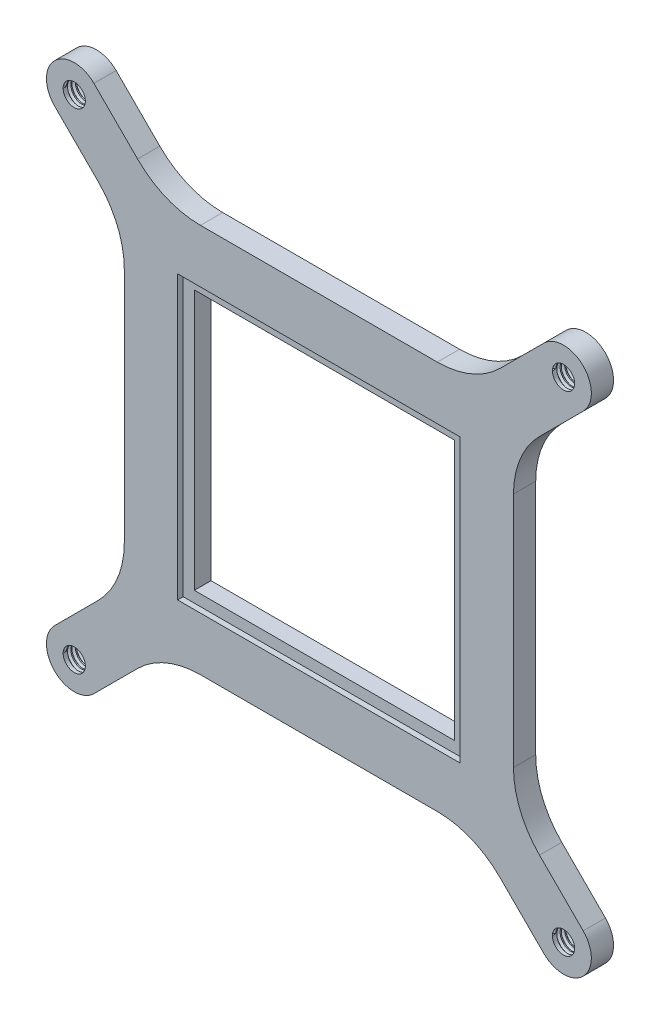
from build123d import *

# Parameters (mm, degrees)
SKETCH1_R           = 1
SKETCH1_W           = 23.4
SKETCH1_H           = 23.4
BOSS_EXTRUDE1_DEPTH = 2
SKETCH2_W           = 25.4
SKETCH2_H           = 25.4
CUT_EXTRUDE1_DEPTH  = 0.5
THREAD1_PITCH       = 0.4
THREAD2_PITCH       = 0.4
THREAD3_PITCH       = 0.4
THREAD4_PITCH       = 0.4


with BuildPart() as part:
    # Sketch1 → Boss-Extrude1 (new body)
    with BuildSketch(Plane.XY):
        with BuildLine():
            Line((-12.350483997, 18.242134063), (8.948233905, 18.242134063))
            ThreePointArc((8.948233905, 18.242134063), (12.00838523, 18.85055278), (14.60307322, 20.583265597))
            Line((14.60307322, 20.583265597), (18.533136312, 24.510530459))
            ThreePointArc((18.533136312, 24.510530459), (22.068040551, 24.509901016), (22.068669993, 20.974996777))
            Line((22.068669993, 20.974996777), (18.141405132, 17.044933685))
            ThreePointArc((18.141405132, 17.044933685), (16.408692315, 14.450245695), (15.800273598, 11.39009437))
            Line((15.800273598, 11.39009437), (15.800273598, -9.905826244))
            ThreePointArc((15.800273598, -9.905826244), (16.408692315, -12.965977569), (18.141405132, -15.560665559))
            Line((18.141405132, -15.560665559), (22.068669993, -19.490728651))
            ThreePointArc((22.068669993, -19.490728651), (22.068040551, -23.02563289), (18.533136312, -23.026262333))
            Line((18.533136312, -23.026262333), (14.60307322, -19.098997471))
            ThreePointArc((14.60307322, -19.098997471), (12.00838523, -17.366284654), (8.948233905, -16.757865937))
            Line((8.948233905, -16.757865937), (-12.350483997, -16.757865937))
            ThreePointArc((-12.350483997, -16.757865937), (-15.411951456, -17.366829677), (-18.007338247, -19.101011688))
            Line((-18.007338247, -19.101011688), (-21.931959449, -23.02563289))
            ThreePointArc((-21.931959449, -23.02563289), (-25.46717855, -23.025947639), (-25.468122798, -19.490728651))
            Line((-25.468122798, -19.490728651), (-21.540857936, -15.560665559))
            ThreePointArc((-21.540857936, -15.560665559), (-19.808145119, -12.965977569), (-19.199726402, -9.905826244))
            Line((-19.199726402, -9.905826244), (-19.199726402, 11.390094453))
            ThreePointArc((-19.199726402, 11.390094453), (-19.808145092, 14.450245713), (-21.540857835, 17.044933668))
            Line((-21.540857835, 17.044933668), (-25.467493355, 20.97436711))
            ThreePointArc((-25.467493355, 20.97436711), (-25.467493355, 24.509901016), (-21.931959449, 24.509901016))
            Line((-21.931959449, 24.509901016), (-18.007338247, 20.585279813))
            ThreePointArc((-18.007338247, 20.585279813), (-15.411951456, 18.851097803), (-12.350483997, 18.242134063))
        make_face()
        with Locations((-23.699726402, 22.742134063)):
            Circle(SKETCH1_R, mode=Mode.SUBTRACT)
        with Locations((20.300273598, 22.742134063)):
            Circle(SKETCH1_R, mode=Mode.SUBTRACT)
        with Locations((20.300273598, -21.257865937)):
            Circle(SKETCH1_R, mode=Mode.SUBTRACT)
        with Locations((-23.699726402, -21.257865937)):
            Circle(SKETCH1_R, mode=Mode.SUBTRACT)
        with Locations((-1.699726402, 0.742134063)):
            Rectangle(SKETCH1_W, SKETCH1_H, mode=Mode.SUBTRACT)
    extrude(amount=BOSS_EXTRUDE1_DEPTH)

    # Sketch2 → Cut-Extrude1 (cut)
    with BuildSketch(Plane.XY.offset(2)):
        with Locations((-1.699726402, 0.742134063)):
            Rectangle(SKETCH2_W, SKETCH2_H)
    extrude(amount=-CUT_EXTRUDE1_DEPTH, mode=Mode.SUBTRACT)

    # Thread1: the profile of Thread Profile1 profile screwed along a right-hand helix of 5 turns, 6 arcs to a turn; built about Z, then put on its axis
    thread1_z = Axis((0, 0, 0), (0, 0, 1))
    thread1_corners = [(0.9997, 0, -0.000173205), (1.21650635, 0, 0.124999999), (1.21650635, 0, 0.174999999), (0.9997, 0, 0.300173204)]
    with BuildLine(mode=Mode.PRIVATE) as thread1_profile:
        Line(thread1_corners[0], thread1_corners[1])
        Line(thread1_corners[1], thread1_corners[2])
        Line(thread1_corners[2], thread1_corners[3])
        Line(thread1_corners[3], thread1_corners[0])
    thread1_cap = Face(thread1_profile.wire())
    thread1_turn_angles = [0, 30, 60, 90, 120, 150, 180, 210, 240, 270, 300, 330, 360]
    thread1_turn_weights = [1, 0.8660254037844387, 1, 0.8660254037844387, 1, 0.8660254037844387, 1, 0.8660254037844387, 1, 0.8660254037844387, 1, 0.8660254037844387, 1]
    thread1_turn_rails = [Edge.make_bspline([Vector(p[0], p[1], 0).rotate(thread1_z, thread1_turn_angles[k]) / thread1_turn_weights[k] + Vector(0, 0, p[2] + THREAD1_PITCH * thread1_turn_angles[k] / 360) for k in range(13)], [0, 0, 0, 1, 1, 2, 2, 3, 3, 4, 4, 5, 5, 6, 6, 6], 2, thread1_turn_weights) for p in thread1_corners]
    thread1_turn_sides = [Face.make_surface_from_curves(thread1_turn_rails[p[0]], thread1_turn_rails[p[1]]) for p in [(0, 1), (1, 2), (2, 3), (3, 0)]]
    thread1 = Plane(origin=(-23.699726402, 22.742134063, 2), x_dir=(-1, 0, 0), z_dir=(0, 0, -1)) * Solid(Shell([*[p.moved(Location((0, 0, THREAD1_PITCH * i))) for i in range(5) for p in thread1_turn_sides], thread1_cap, thread1_cap.rotate(thread1_z, 1800).moved(Location((0, 0, THREAD1_PITCH * 1800 / 360)))]))
    add(thread1, mode=Mode.SUBTRACT)

    # Thread2: the profile of Thread Profile2 profile screwed along a right-hand helix of 5 turns, 6 arcs to a turn; built about Z, then put on its axis
    thread2_z = Axis((0, 0, 0), (0, 0, 1))
    thread2_corners = [(0.9997, 0, -0.000173205), (1.21650635, 0, 0.124999999), (1.21650635, 0, 0.174999999), (0.9997, 0, 0.300173204)]
    with BuildLine(mode=Mode.PRIVATE) as thread2_profile:
        Line(thread2_corners[0], thread2_corners[1])
        Line(thread2_corners[1], thread2_corners[2])
        Line(thread2_corners[2], thread2_corners[3])
        Line(thread2_corners[3], thread2_corners[0])
    thread2_cap = Face(thread2_profile.wire())
    thread2_turn_angles = [0, 30, 60, 90, 120, 150, 180, 210, 240, 270, 300, 330, 360]
    thread2_turn_weights = [1, 0.8660254037844387, 1, 0.8660254037844387, 1, 0.8660254037844387, 1, 0.8660254037844387, 1, 0.8660254037844387, 1, 0.8660254037844387, 1]
    thread2_turn_rails = [Edge.make_bspline([Vector(p[0], p[1], 0).rotate(thread2_z, thread2_turn_angles[k]) / thread2_turn_weights[k] + Vector(0, 0, p[2] + THREAD2_PITCH * thread2_turn_angles[k] / 360) for k in range(13)], [0, 0, 0, 1, 1, 2, 2, 3, 3, 4, 4, 5, 5, 6, 6, 6], 2, thread2_turn_weights) for p in thread2_corners]
    thread2_turn_sides = [Face.make_surface_from_curves(thread2_turn_rails[p[0]], thread2_turn_rails[p[1]]) for p in [(0, 1), (1, 2), (2, 3), (3, 0)]]
    thread2 = Plane(origin=(20.300273598, 22.742134063, 2), x_dir=(-1, 0, 0), z_dir=(0, 0, -1)) * Solid(Shell([*[p.moved(Location((0, 0, THREAD2_PITCH * i))) for i in range(5) for p in thread2_turn_sides], thread2_cap, thread2_cap.rotate(thread2_z, 1800).moved(Location((0, 0, THREAD2_PITCH * 1800 / 360)))]))
    add(thread2, mode=Mode.SUBTRACT)

    # Thread3: the profile of Thread Profile3 profile screwed along a right-hand helix of 5 turns, 6 arcs to a turn; built about Z, then put on its axis
    thread3_z = Axis((0, 0, 0), (0, 0, 1))
    thread3_corners = [(0.9997, 0, -0.000173205), (1.21650635, 0, 0.124999999), (1.21650635, 0, 0.174999999), (0.9997, 0, 0.300173204)]
    with BuildLine(mode=Mode.PRIVATE) as thread3_profile:
        Line(thread3_corners[0], thread3_corners[1])
        Line(thread3_corners[1], thread3_corners[2])
        Line(thread3_corners[2], thread3_corners[3])
        Line(thread3_corners[3], thread3_corners[0])
    thread3_cap = Face(thread3_profile.wire())
    thread3_turn_angles = [0, 30, 60, 90, 120, 150, 180, 210, 240, 270, 300, 330, 360]
    thread3_turn_weights = [1, 0.8660254037844387, 1, 0.8660254037844387, 1, 0.8660254037844387, 1, 0.8660254037844387, 1, 0.8660254037844387, 1, 0.8660254037844387, 1]
    thread3_turn_rails = [Edge.make_bspline([Vector(p[0], p[1], 0).rotate(thread3_z, thread3_turn_angles[k]) / thread3_turn_weights[k] + Vector(0, 0, p[2] + THREAD3_PITCH * thread3_turn_angles[k] / 360) for k in range(13)], [0, 0, 0, 1, 1, 2, 2, 3, 3, 4, 4, 5, 5, 6, 6, 6], 2, thread3_turn_weights) for p in thread3_corners]
    thread3_turn_sides = [Face.make_surface_from_curves(thread3_turn_rails[p[0]], thread3_turn_rails[p[1]]) for p in [(0, 1), (1, 2), (2, 3), (3, 0)]]
    thread3 = Plane(origin=(-23.699726402, -21.257865937, 2), x_dir=(-1, 0, 0), z_dir=(0, 0, -1)) * Solid(Shell([*[p.moved(Location((0, 0, THREAD3_PITCH * i))) for i in range(5) for p in thread3_turn_sides], thread3_cap, thread3_cap.rotate(thread3_z, 1800).moved(Location((0, 0, THREAD3_PITCH * 1800 / 360)))]))
    add(thread3, mode=Mode.SUBTRACT)

    # Thread4: the profile of Thread Profile4 profile screwed along a right-hand helix of 5 turns, 6 arcs to a turn; built about Z, then put on its axis
    thread4_z = Axis((0, 0, 0), (0, 0, 1))
    thread4_corners = [(0.9997, 0, -0.000173205), (1.21650635, 0, 0.124999999), (1.21650635, 0, 0.174999999), (0.9997, 0, 0.300173204)]
    with BuildLine(mode=Mode.PRIVATE) as thread4_profile:
        Line(thread4_corners[0], thread4_corners[1])
        Line(thread4_corners[1], thread4_corners[2])
        Line(thread4_corners[2], thread4_corners[3])
        Line(thread4_corners[3], thread4_corners[0])
    thread4_cap = Face(thread4_profile.wire())
    thread4_turn_angles = [0, 30, 60, 90, 120, 150, 180, 210, 240, 270, 300, 330, 360]
    thread4_turn_weights = [1, 0.8660254037844387, 1, 0.8660254037844387, 1, 0.8660254037844387, 1, 0.8660254037844387, 1, 0.8660254037844387, 1, 0.8660254037844387, 1]
    thread4_turn_rails = [Edge.make_bspline([Vector(p[0], p[1], 0).rotate(thread4_z, thread4_turn_angles[k]) / thread4_turn_weights[k] + Vector(0, 0, p[2] + THREAD4_PITCH * thread4_turn_angles[k] / 360) for k in range(13)], [0, 0, 0, 1, 1, 2, 2, 3, 3, 4, 4, 5, 5, 6, 6, 6], 2, thread4_turn_weights) for p in thread4_corners]
    thread4_turn_sides = [Face.make_surface_from_curves(thread4_turn_rails[p[0]], thread4_turn_rails[p[1]]) for p in [(0, 1), (1, 2), (2, 3), (3, 0)]]
    thread4 = Plane(origin=(20.300273598, -21.257865937, 2), x_dir=(-1, 0, 0), z_dir=(0, 0, -1)) * Solid(Shell([*[p.moved(Location((0, 0, THREAD4_PITCH * i))) for i in range(5) for p in thread4_turn_sides], thread4_cap, thread4_cap.rotate(thread4_z, 1800).moved(Location((0, 0, THREAD4_PITCH * 1800 / 360)))]))
    add(thread4, mode=Mode.SUBTRACT)


solid = part.part
